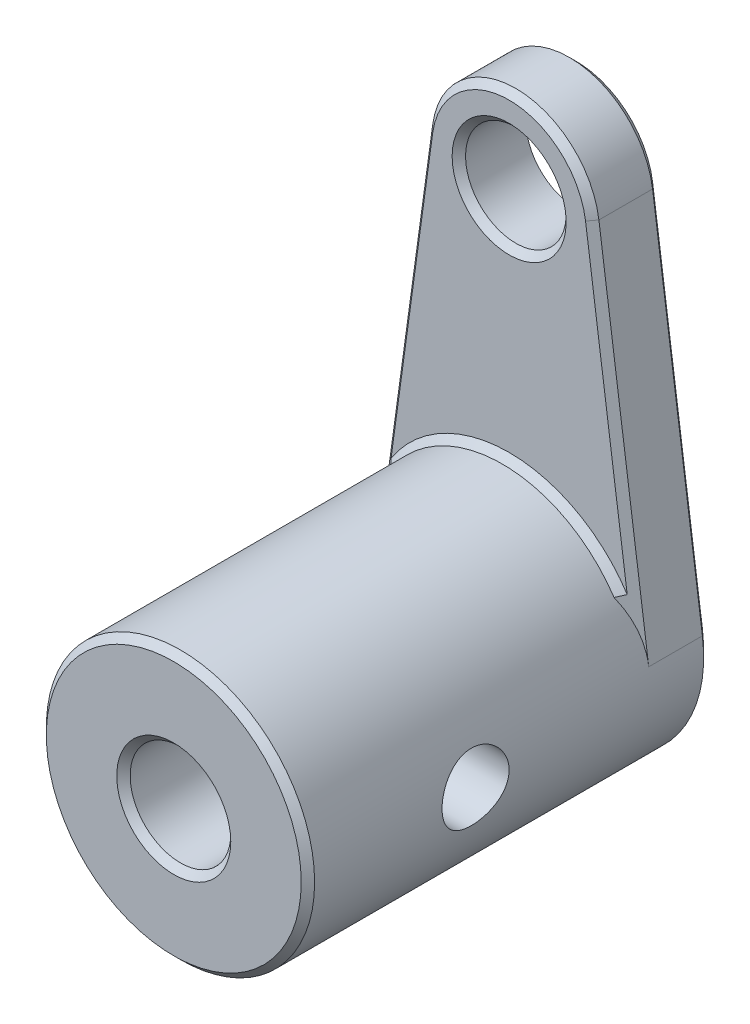
from build123d import *

# Parameters (mm, degrees)
SKETCH1_R               = 1.5
BOSS_EXTRUDE1_DEPTH     = 2
SKETCH2_R               = 4
SKETCH2_R_2             = 1.5
BOSS_EXTRUDE2_DEPTH     = 10
CUT_EXTRUDE1_DEPTH      = 19.5
CUT_EXTRUDE1_DEPTH_BACK = 19.5
SKETCH3_R               = 1
CHAMFER1_SIZE           = 0.2
CHAMFER2_SIZE           = 0.2


with BuildPart() as part:
    # Sketch1 → Boss-Extrude1 (new body)
    with BuildSketch(Plane.XY):
        with BuildLine():
            Line((-2.476647127, 11.340909091), (-3.962635403, 0.545454545))
            ThreePointArc((-3.962635403, 0.545454545), (0, -4), (3.962635403, 0.545454545))
            Line((3.962635403, 0.545454545), (2.476647127, 11.340909091))
            ThreePointArc((2.476647127, 11.340909091), (0, 13.5), (-2.476647127, 11.340909091))
        make_face()
        with Locations((0, 11)):
            Circle(SKETCH1_R, mode=Mode.SUBTRACT)
        Circle(SKETCH1_R, mode=Mode.SUBTRACT)
    extrude(amount=BOSS_EXTRUDE1_DEPTH)

    # Sketch2 → Boss-Extrude2 (add)
    with BuildSketch(Plane.XY.offset(2)):
        with Locations(Location((0, 0, 0), (0, 0, 172.162520237))):
            Circle(SKETCH2_R)
        Circle(SKETCH2_R_2, mode=Mode.SUBTRACT)
    extrude(amount=BOSS_EXTRUDE2_DEPTH)

    # Sketch3 → Cut-Extrude1 (cut, two sides: drawn at the far end of the back side and taken through both)
    with BuildSketch(Plane(origin=(0, 0, 0), x_dir=(0, 0, -1), z_dir=(1, 0, 0)).offset(-CUT_EXTRUDE1_DEPTH_BACK)):
        with Locations((-7, 0)):
            Circle(SKETCH3_R)
    extrude(amount=CUT_EXTRUDE1_DEPTH + CUT_EXTRUDE1_DEPTH_BACK, mode=Mode.SUBTRACT)

    # Chamfer1
    # the kernel refuses this chamfer: 0.2 mm, written as the material it takes off along each edge
    with BuildSketch(Plane(origin=(0, 11, 2), x_dir=(1, 0, 0), z_dir=(0, -1, 0))) as chamfer1_piece_1:
        Polygon((1.5 + CHAMFER1_SIZE, 0), (1.5, -CHAMFER1_SIZE), (1.5, 0), align=None)
    revolve(axis=Axis((0, 11, 2), (0, 0, 1)), mode=Mode.SUBTRACT)
    with BuildSketch(Plane(origin=(0, 11, 2), x_dir=(0.9906588508046985, 0.13636363636363596, 0), z_dir=(0.13636363636363596, -0.9906588508046985, 0))) as chamfer1_piece_2:
        Polygon((2.5, -CHAMFER1_SIZE), (2.5 - CHAMFER1_SIZE, 0), (2.5, 0), align=None)
    revolve(axis=Axis((0, 11, 2), (0, 0, 1)), revolution_arc=164.325040474, mode=Mode.SUBTRACT)
    with BuildSketch(Plane(origin=(-2.476647127, 11.340909091, 2), x_dir=(0.9902842994465351, -0.13631207957881322, 0.02749587661058738), z_dir=(-0.1363636363636364, -0.9906588508046986, 0))) as chamfer1_piece_3_section:
        Polygon((CHAMFER1_SIZE * 0.999621916911, -CHAMFER1_SIZE * 0.0274958766106), (-CHAMFER1_SIZE * 0.0274958766106, -CHAMFER1_SIZE * 0.999621916911), (0, 0), align=None)
    chamfer1_piece_3 = extrude(amount=11.411583956, mode=Mode.PRIVATE)
    chamfer1_piece_3 = chamfer1_piece_3 - Plane(origin=(0, 0, 1.932985059), x_dir=(-0.9906588508048991, 0.13636363636217924, 0), z_dir=(0, 0, -1)) * Cylinder(4, 24, mode=Mode.PRIVATE)
    add(chamfer1_piece_3, mode=Mode.SUBTRACT)
    with BuildSketch(Plane(origin=(0, 0, 12), x_dir=(-0.9906588508048991, 0.13636363636217924, 0), z_dir=(0.13636363636217924, 0.9906588508048991, 0))) as chamfer1_piece_4:
        Polygon((4, -CHAMFER1_SIZE), (4 - CHAMFER1_SIZE, 0), (4, 0), align=None)
    revolve(axis=Axis((0, 0, 12), (0, 0, 1)), mode=Mode.SUBTRACT)
    with BuildSketch(Plane(origin=(0, 0, 12), x_dir=(1, 0, 0), z_dir=(0, -1, 0))) as chamfer1_piece_5:
        Polygon((1.5, -CHAMFER1_SIZE), (1.5 + CHAMFER1_SIZE, 0), (1.5, 0), align=None)
    revolve(axis=Axis((0, 0, 12), (0, 0, 1)), mode=Mode.SUBTRACT)
    with BuildSketch(Plane(origin=(-2.476647127, 11.340909091, 0), x_dir=(0.9902842994465351, -0.13631207957881322, -0.027495876610586414), z_dir=(-0.1363636363636364, -0.9906588508046986, 0))) as chamfer1_piece_6:
        Polygon((CHAMFER1_SIZE * 0.999621916911, CHAMFER1_SIZE * 0.0274958766106), (-CHAMFER1_SIZE * 0.0274958766106, CHAMFER1_SIZE * 0.999621916911), (0, 0), align=None)
    extrude(amount=10.897247359, mode=Mode.SUBTRACT)
    with BuildSketch(Plane(origin=(0, 11, 0), x_dir=(0.9906588508046985, 0.13636363636363596, 0), z_dir=(0.13636363636363596, -0.9906588508046985, 0))) as chamfer1_piece_7:
        Polygon((2.5, CHAMFER1_SIZE), (2.5 - CHAMFER1_SIZE, 0), (2.5, 0), align=None)
    revolve(axis=Axis((0, 11, 0), (0, 0, 1)), revolution_arc=164.325040474, mode=Mode.SUBTRACT)
    with BuildSketch(Plane(origin=(3.962635403, 0.545454545, 0), x_dir=(0.027239033524910743, 0.0037494377196253415, 0.9996219169112968), z_dir=(-0.1363636363636364, 0.9906588508046986, 0))) as chamfer1_piece_8:
        Polygon((CHAMFER1_SIZE * 0.999621916911, -CHAMFER1_SIZE * 0.0274958766106), (-CHAMFER1_SIZE * 0.0274958766106, -CHAMFER1_SIZE * 0.999621916911), (0, 0), align=None)
    extrude(amount=10.897247359, mode=Mode.SUBTRACT)
    with BuildSketch(Plane(origin=(0, 0, 0), x_dir=(-0.9906588508046986, 0.13636363636363646, 0), z_dir=(0.13636363636363646, 0.9906588508046986, 0))) as chamfer1_piece_9:
        Polygon((4, CHAMFER1_SIZE), (4 - CHAMFER1_SIZE, 0), (4, 0), align=None)
    revolve(axis=Axis((0, 0, 0), (0, 0, 1)), revolution_arc=195.674959526, mode=Mode.SUBTRACT)
    with BuildSketch(Plane(origin=(4.032772212, 0.035922443, 2), x_dir=(0.02723903352491077, 0.003749437719625345, -0.9996219169112968), z_dir=(-0.1363636363636364, 0.9906588508046986, 0))) as chamfer1_piece_10_section:
        Polygon((CHAMFER1_SIZE * 0.999621916911, CHAMFER1_SIZE * 0.0274958766106), (-CHAMFER1_SIZE * 0.0274958766106, CHAMFER1_SIZE * 0.999621916911), (0, 0), align=None)
    chamfer1_piece_10 = extrude(amount=11.411583956, mode=Mode.PRIVATE)
    chamfer1_piece_10 = chamfer1_piece_10 - Plane(origin=(0, 0, 1.932985114), x_dir=(-0.9906588508048991, 0.13636363636217924, 0), z_dir=(0, 0, -1)) * Cylinder(4, 24, mode=Mode.PRIVATE)
    add(chamfer1_piece_10, mode=Mode.SUBTRACT)

    # Chamfer2
    # the kernel refuses this chamfer: 0.2 mm, written as the material it adds along each edge
    with BuildSketch(Plane(origin=(0, 0, 2), x_dir=(0.9474392315450817, 0.31993577875765195, 0), z_dir=(0.31993577875765195, -0.9474392315450817, 0))) as chamfer2_piece_1_section:
        Polygon((4 + CHAMFER2_SIZE, 0), (4, CHAMFER2_SIZE), (4, 0), align=None)
    chamfer2_piece_1 = revolve(axis=Axis((0, 0, 2), (0, 0, 1)), revolution_arc=142.681917796, mode=Mode.PRIVATE)
    chamfer2_piece_1 = split(chamfer2_piece_1, bisect_by=Plane(origin=(1.558048565, 4.310442532, 3.668717781), z_dir=(-0.700501591246356, -0.0964236519801952, -0.7071067811866362)), keep=Keep.TOP, mode=Mode.PRIVATE)
    chamfer2_piece_1 = split(chamfer2_piece_1, bisect_by=Plane(origin=(-1.558048565, 4.310442532, 3.668717781), z_dir=(0.7005015912467089, -0.09642365198024379, -0.70710678118628)), keep=Keep.TOP, mode=Mode.PRIVATE)
    add(chamfer2_piece_1)


solid = part.part
